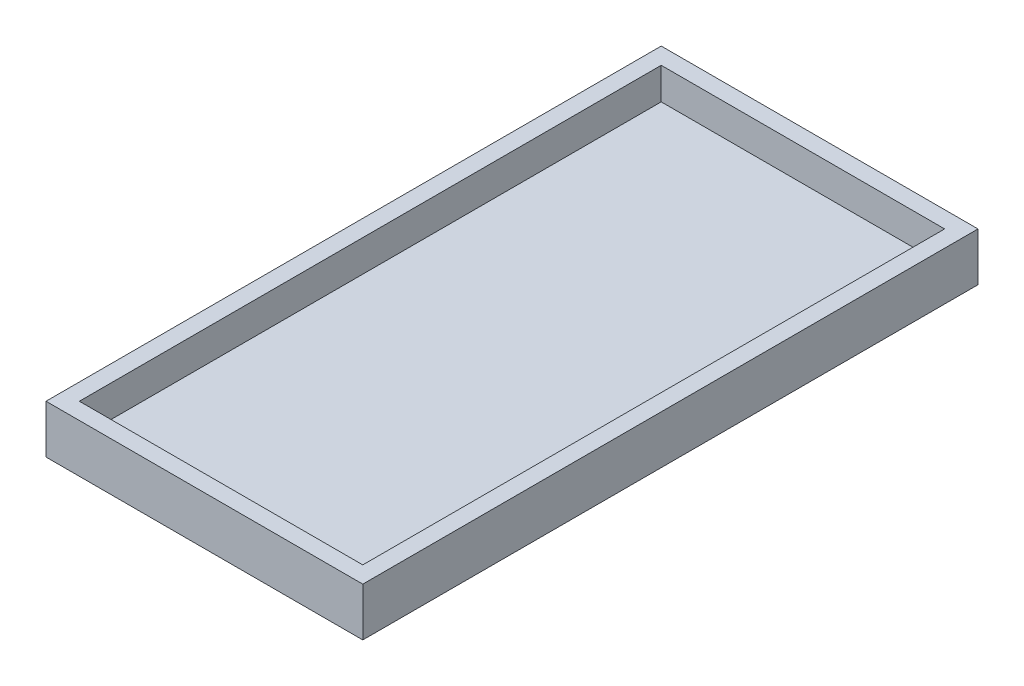
from build123d import *

# Parameters (mm, degrees)
SKETCH1_W           = 38
SKETCH1_H           = 73.8
BOSS_EXTRUDE1_DEPTH = 2
SKETCH2_W           = 38
SKETCH2_H           = 73.8
SKETCH2_W_2         = 34
SKETCH2_H_2         = 69.8
BOSS_EXTRUDE2_DEPTH = 3.8


with BuildPart() as part:
    # Sketch1 → Boss-Extrude1 (new body)
    with BuildSketch(Plane(origin=(0, 0, 0), x_dir=(1, 0, 0), z_dir=(0, 1, 0))):
        Rectangle(SKETCH1_W, SKETCH1_H)
    extrude(amount=BOSS_EXTRUDE1_DEPTH)

    # Sketch2 → Boss-Extrude2 (add)
    with BuildSketch(Plane(origin=(0, 2, 0), x_dir=(1, 0, 0), z_dir=(0, 1, 0))):
        Rectangle(SKETCH2_W, SKETCH2_H)
        Rectangle(SKETCH2_W_2, SKETCH2_H_2, mode=Mode.SUBTRACT)
    extrude(amount=BOSS_EXTRUDE2_DEPTH)


solid = part.part
